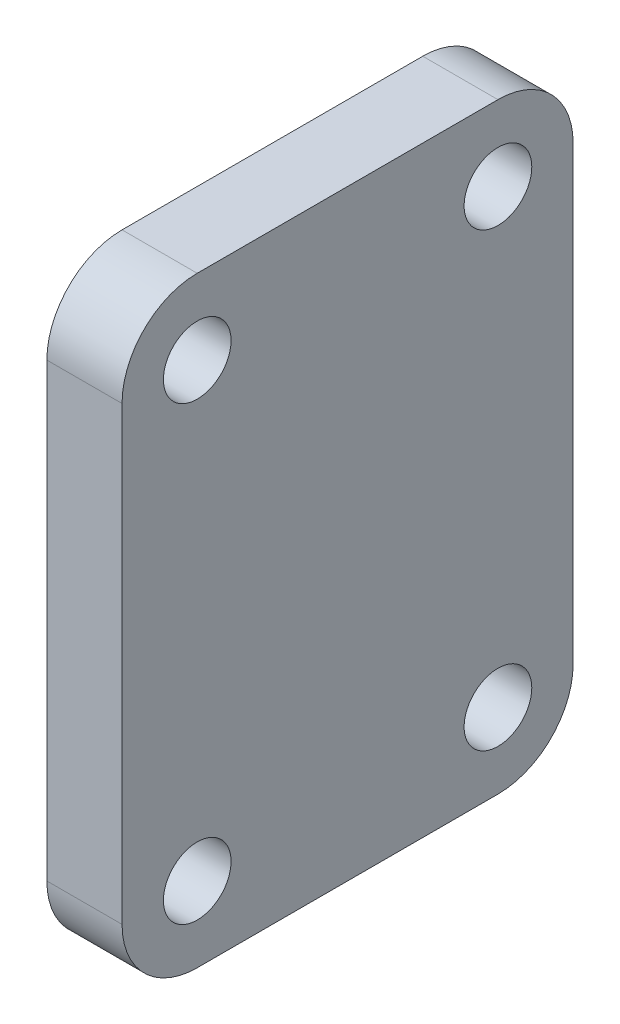
from build123d import *

# Parameters (mm, degrees)
SKETCH_1_W                 = 30
SKETCH_1_H                 = 40
EXTRUDE_1_DEPTH            = 5
HOLE_WIZARD_M4_1_OUTLINE_R = 2.25
HOLE_WIZARD_M4_1_DEPTH     = 5
FILLET_1_R                 = 5


# Read off the part's stored shape, not the designer's step: M4 间隙孔1
with BuildPart() as part:
    # 草图1 → 凸台-拉伸1 (new body)
    with BuildSketch(Plane(origin=(0, 0, 0), x_dir=(0, 0, -1), z_dir=(1, 0, 0))):
        with Locations((15, 20)):
            Rectangle(SKETCH_1_W, SKETCH_1_H)
    extrude(amount=EXTRUDE_1_DEPTH)

    # M4 间隙孔1 outline → M4 间隙孔1 (cut)
    with BuildSketch(Plane.YZ):
        with Locations((35, -5)):
            Circle(HOLE_WIZARD_M4_1_OUTLINE_R)
        with Locations((5, -25)):
            Circle(HOLE_WIZARD_M4_1_OUTLINE_R)
        with Locations((5, -5)):
            Circle(HOLE_WIZARD_M4_1_OUTLINE_R)
        with Locations((35, -25)):
            Circle(HOLE_WIZARD_M4_1_OUTLINE_R)
    extrude(amount=HOLE_WIZARD_M4_1_DEPTH, mode=Mode.SUBTRACT)

    # 圆角1
    fillet_1_edges = [part.edges().sort_by_distance(p)[0] for p in [
        (2.5, 40, 0),
        (2.5, 40, -30),
        (2.5, 0, -30),
        (2.5, 0, 0),
    ]]
    fillet(fillet_1_edges, radius=FILLET_1_R)


solid = part.part
